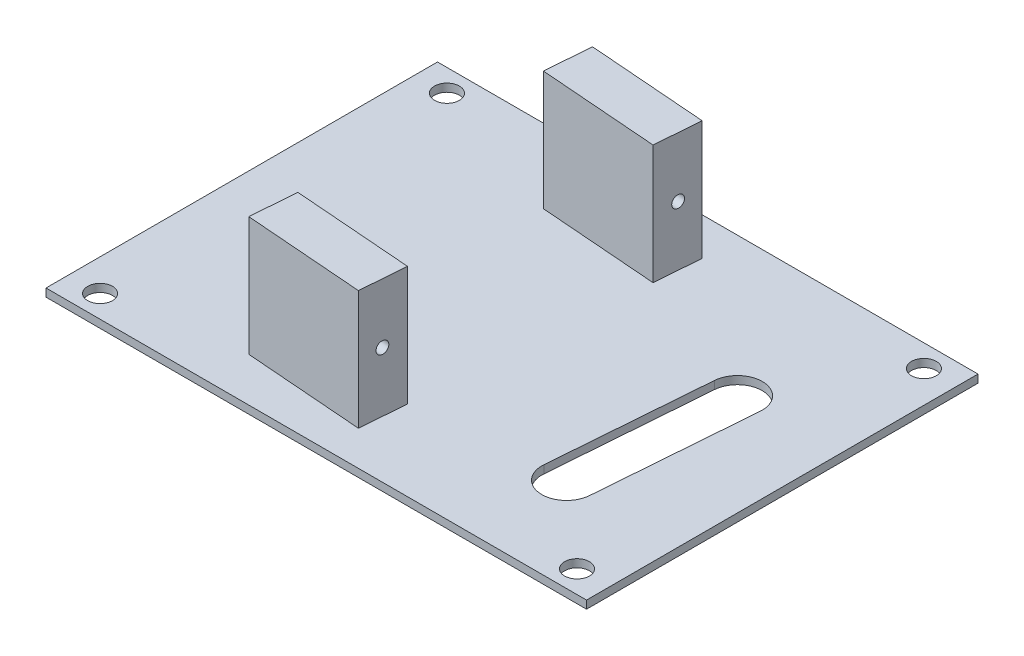
from build123d import *

# Parameters (mm, degrees)
IZIM1_W                     = 54.4
IZIM1_H                     = 39.4
Y_KSEKLIK_EKSTR_ZYON1_DEPTH = 0.8
IZIM2_R                     = 1.25
KES_EKSTR_ZYON1_DEPTH       = 68.174102153
Y_KSEKLIK_EKSTR_ZYON2_DEPTH = 12
KES_EKSTR_ZYON2_DEPTH       = 69.23283667
IZIM4_R                     = 0.6
KES_EKSTR_ZYON3_DEPTH       = 6


with BuildPart() as part:
    # Çizim1 → Yükseklik-Ekstrüzyon1 (new body)
    with BuildSketch(Plane(origin=(0, 0, 0), x_dir=(1, 0, 0), z_dir=(0, 1, 0))):
        with Locations((27.2, 19.7)):
            Rectangle(IZIM1_W, IZIM1_H)
    extrude(amount=Y_KSEKLIK_EKSTR_ZYON1_DEPTH)

    # Çizim2 → Kes-Ekstrüzyon1 (cut, through all)
    with BuildSketch(Plane(origin=(0, 0.8, 0), x_dir=(1, 0, 0), z_dir=(0, 1, 0))):
        with Locations((3.2, 37.155)):
            Circle(IZIM2_R)
        with Locations((51.2, 37.155)):
            Circle(IZIM2_R)
        with Locations((3.2, 2.245)):
            Circle(IZIM2_R)
        with Locations((51.2, 2.245)):
            Circle(IZIM2_R)
    extrude(amount=-KES_EKSTR_ZYON1_DEPTH, mode=Mode.SUBTRACT)

    # Çizim3 → Yükseklik-Ekstrüzyon2 (add)
    with BuildSketch(Plane(origin=(0, 0.8, 0), x_dir=(1, 0, 0), z_dir=(0, 1, 0))):
        Polygon((16.339737047, 9.008662918), (15.983627663, 4.422467752), (27.947615054, 3.49348675), (28.303724438, 8.079681916), align=None)
        Polygon((30.440380743, 35.596852916), (18.476393352, 36.525833918), (18.120283968, 31.939638752), (30.084271359, 31.01065775), align=None)
    extrude(amount=Y_KSEKLIK_EKSTR_ZYON2_DEPTH)

    # Çizim3<3> → Kes-Ekstrüzyon2 (cut, through all)
    with BuildSketch(Plane(origin=(0, 0.8, 0), x_dir=(1, 0, 0), z_dir=(0, 1, 0))):
        with BuildLine():
            Line((45.445893026, 9.251599144), (46.684534362, 25.203582332))
            ThreePointArc((46.684534362, 25.203582332), (44.385574697, 27.889617414), (41.699539616, 25.59065775))
            Line((41.699539616, 25.59065775), (40.460898279, 9.638674561))
            ThreePointArc((40.460898279, 9.638674561), (42.759857944, 6.952639479), (45.445893026, 9.251599144))
        make_face()
    extrude(amount=-KES_EKSTR_ZYON2_DEPTH, mode=Mode.SUBTRACT)

    # Çizim4 → Kes-Ekstrüzyon3 (cut)
    with BuildSketch(Plane(origin=(27.510485399, 0, 2.136137181), x_dir=(0.07741508350800423, 0, -0.9969989492699823), z_dir=(0.9969989492699823, 0, 0.07741508350800423))):
        with Locations((7.896569572, 6.8)):
            Circle(IZIM4_R)
        with Locations((35.596569572, 6.8)):
            Circle(IZIM4_R)
    extrude(amount=-KES_EKSTR_ZYON3_DEPTH, mode=Mode.SUBTRACT)


solid = part.part
